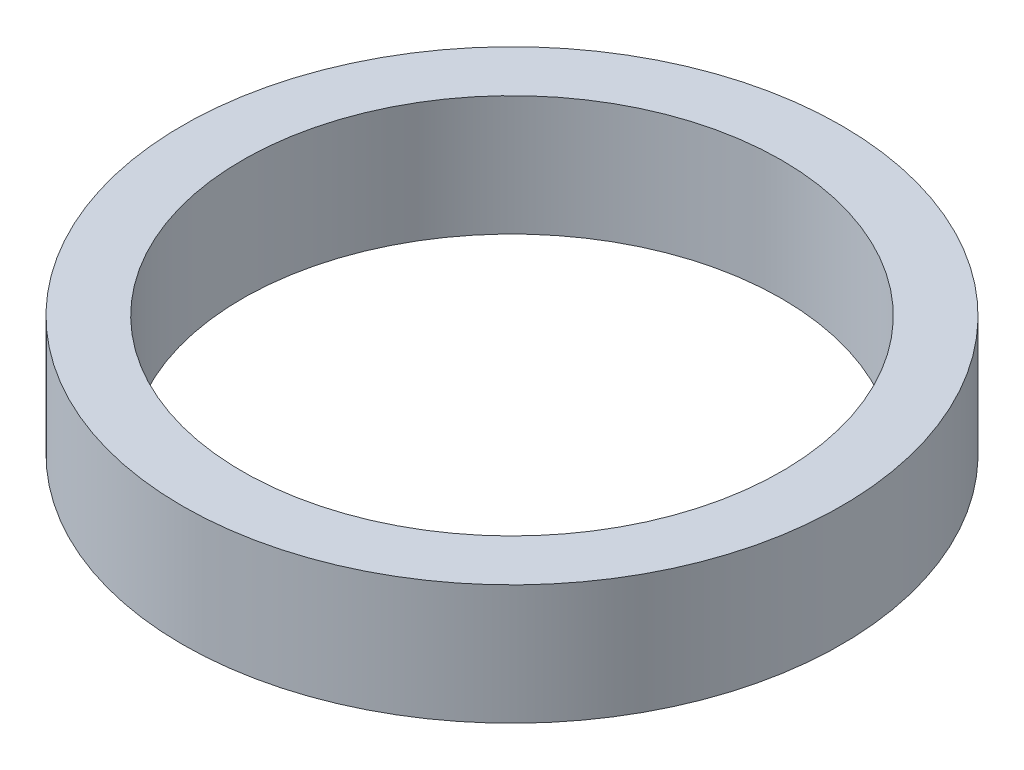
from build123d import *

# Parameters (mm, degrees)
SKETCH_1_W                = 10
SKETCH_1_H                = 200
SURFACE_START             = -80
SURFACE_CUT_1_OUTLINE_R   = 55
SURFACE_CUT_1_OUTLINE_R_2 = 45
SURFACE_CUT_1_DEPTH       = 180


# Read off the part's stored shape, not the designer's step: Сечение1
with BuildPart() as part:
    # Эскиз1 → Повернуть1 (revolve)
    with BuildSketch(Plane.XY, mode=Mode.PRIVATE) as revolve_1_sk:
        with Locations((50, 0)):
            Rectangle(SKETCH_1_W, SKETCH_1_H)
    revolve(revolve_1_sk.sketch.rotate(Axis((0, -110.603092707, 0), (0, 1, 0)), 90), axis=Axis((0, -110.603092707, 0), (0, 1, 0)))

    # Surface Cut 1 outline → Surface Cut 1 (cut)
    with BuildSketch(Plane(origin=(0, 0, 0), x_dir=(1, 0, 0), z_dir=(0, 1, 0)).offset(SURFACE_START)):
        Circle(SURFACE_CUT_1_OUTLINE_R)
        Circle(SURFACE_CUT_1_OUTLINE_R_2, mode=Mode.SUBTRACT)
    extrude(amount=SURFACE_CUT_1_DEPTH, mode=Mode.SUBTRACT)


solid = part.part
